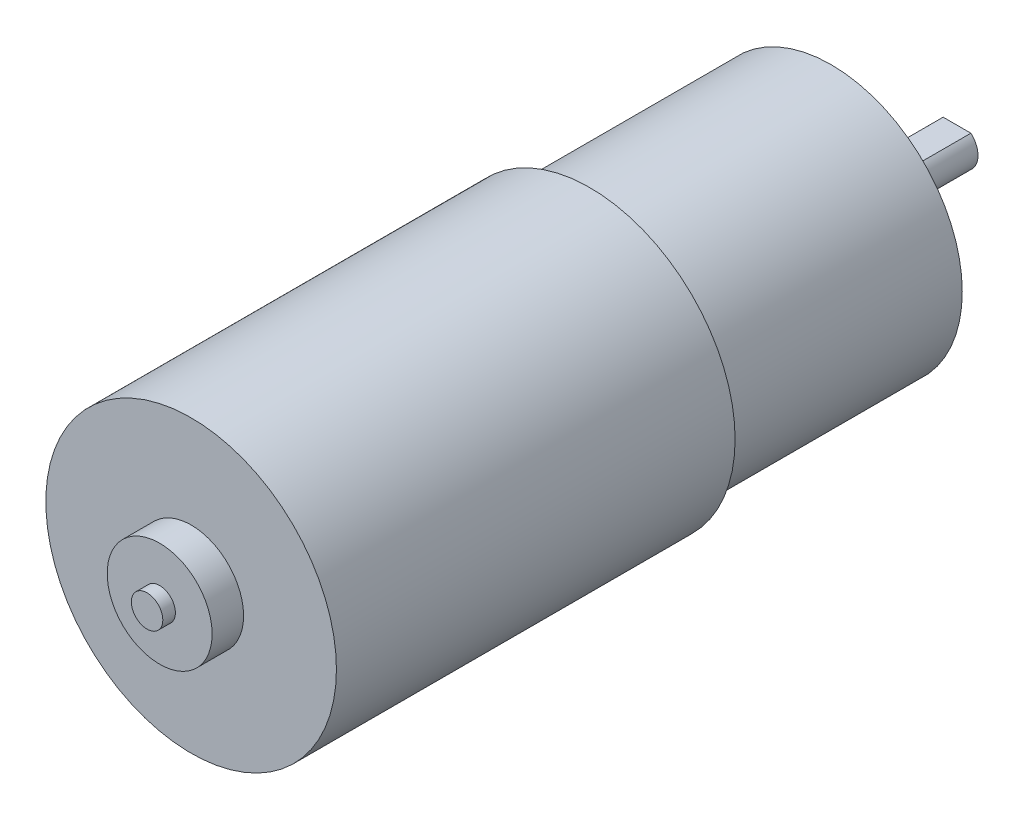
from build123d import *
from build123d.topology import SkipClean

# Parameters (mm, degrees)
SKETCH1_R           = 12.5
BOSS_EXTRUDE1_DEPTH = 23
SKETCH2_R           = 13.85
BOSS_EXTRUDE2_DEPTH = 38
SKETCH3_R           = 5
BOSS_EXTRUDE3_DEPTH = 3
SKETCH4_R           = 1.5
BOSS_EXTRUDE4_DEPTH = 1.2
SKETCH5_R           = 3.5
BOSS_EXTRUDE5_DEPTH = 2.5
SKETCH6_R           = 2
BOSS_EXTRUDE6_DEPTH = 9.5
CUT_EXTRUDE1_START  = -8
CUT_EXTRUDE1_DEPTH  = 8
SKETCH8_R           = 1.5
CUT_EXTRUDE3_DEPTH  = 6.5
THREAD2_PITCH       = 0.5
THREAD3_PITCH       = 0.5


with BuildPart() as part:
    # Sketch1 → Boss-Extrude1 (new body)
    with BuildSketch(Plane.XY):
        Circle(SKETCH1_R)
    extrude(amount=BOSS_EXTRUDE1_DEPTH)

    # Sketch2 → Boss-Extrude2 (add)
    with BuildSketch(Plane.XY.offset(23)):
        Circle(SKETCH2_R)
    extrude(amount=BOSS_EXTRUDE2_DEPTH)

    # Sketch3 → Boss-Extrude3 (add)
    with BuildSketch(Plane.XY.offset(61)):
        Circle(SKETCH3_R)
    extrude(amount=BOSS_EXTRUDE3_DEPTH)

    # Sketch4 → Boss-Extrude4 (add)
    with BuildSketch(Plane.XY.offset(64)):
        Circle(SKETCH4_R)
    extrude(amount=BOSS_EXTRUDE4_DEPTH)

    # Sketch5 → Boss-Extrude5 (add)
    with BuildSketch(Plane.XY):
        Circle(SKETCH5_R)
    extrude(amount=-BOSS_EXTRUDE5_DEPTH)

    # Sketch6 → Boss-Extrude6 (add)
    with BuildSketch(Plane(origin=(0, 0, -2.5), x_dir=(-1, 0, 0), z_dir=(0, 0, -1))):
        Circle(SKETCH6_R)
    extrude(amount=BOSS_EXTRUDE6_DEPTH)

    # Sketch7 → Cut-Extrude1 (cut)
    with BuildSketch(Plane(origin=(0, 0, -12), x_dir=(-1, 0, 0), z_dir=(0, 0, -1)).offset(CUT_EXTRUDE1_START)):
        with BuildLine():
            Line((-1.322875656, 1.5), (1.322875656, 1.5))
            ThreePointArc((1.322875656, 1.5), (0, 2), (-1.322875656, 1.5))
        make_face()
    extrude(amount=CUT_EXTRUDE1_DEPTH, mode=Mode.SUBTRACT)

    # Sketch8 → Cut-Extrude3 (cut)
    with BuildSketch(Plane(origin=(0, 0, 0), x_dir=(-1, 0, 0), z_dir=(0, 0, -1))):
        with Locations((0, 8.5)):
            Circle(SKETCH8_R)
        with Locations((0, -8.5)):
            Circle(SKETCH8_R)
    extrude(amount=-CUT_EXTRUDE3_DEPTH, mode=Mode.SUBTRACT)

    # Thread2: the profile of Thread Profile2 profile screwed along a right-hand helix of 13 turns, 6 arcs to a turn; built about Z, then put on its axis
    with SkipClean():  # the faces are left unmerged after this step: merging them gives an invalid solid
        thread2_z = Axis((0, 0, 0), (0, 0, 1))
        thread2_corners = [(1.4997, 0, -0.000173205), (1.770632937, 0, 0.156249999), (1.770632937, 0, 0.218749999), (1.4997, 0, 0.375173204)]
        with BuildLine(mode=Mode.PRIVATE) as thread2_profile:
            Line(thread2_corners[0], thread2_corners[1])
            Line(thread2_corners[1], thread2_corners[2])
            Line(thread2_corners[2], thread2_corners[3])
            Line(thread2_corners[3], thread2_corners[0])
        thread2_cap = Face(thread2_profile.wire())
        thread2_turn_angles = [0, 30, 60, 90, 120, 150, 180, 210, 240, 270, 300, 330, 360]
        thread2_turn_weights = [1, 0.8660254037844387, 1, 0.8660254037844387, 1, 0.8660254037844387, 1, 0.8660254037844387, 1, 0.8660254037844387, 1, 0.8660254037844387, 1]
        thread2_turn_rails = [Edge.make_bspline([Vector(p[0], p[1], 0).rotate(thread2_z, thread2_turn_angles[k]) / thread2_turn_weights[k] + Vector(0, 0, p[2] + THREAD2_PITCH * thread2_turn_angles[k] / 360) for k in range(13)], [0, 0, 0, 1, 1, 2, 2, 3, 3, 4, 4, 5, 5, 6, 6, 6], 2, thread2_turn_weights) for p in thread2_corners]
        thread2_turn_sides = [Face.make_surface_from_curves(thread2_turn_rails[p[0]], thread2_turn_rails[p[1]]) for p in [(0, 1), (1, 2), (2, 3), (3, 0)]]
        thread2 = Plane(origin=(0, -8.5, 0), x_dir=(1, 0, 0), z_dir=(0, 0, 1)) * Solid(Shell([*[p.moved(Location((0, 0, THREAD2_PITCH * i))) for i in range(13) for p in thread2_turn_sides], thread2_cap, thread2_cap.rotate(thread2_z, 4680).moved(Location((0, 0, THREAD2_PITCH * 4680 / 360)))]))
        add(thread2, mode=Mode.SUBTRACT)

    # Thread3: the profile of Thread Profile3 profile screwed along a right-hand helix of 13 turns, 6 arcs to a turn; built about Z, then put on its axis
    with SkipClean():  # the faces are left unmerged after this step: merging them gives an invalid solid
        thread3_z = Axis((0, 0, 0), (0, 0, 1))
        thread3_corners = [(1.4997, 0, -0.000173205), (1.770632937, 0, 0.156249999), (1.770632937, 0, 0.218749999), (1.4997, 0, 0.375173204)]
        with BuildLine(mode=Mode.PRIVATE) as thread3_profile:
            Line(thread3_corners[0], thread3_corners[1])
            Line(thread3_corners[1], thread3_corners[2])
            Line(thread3_corners[2], thread3_corners[3])
            Line(thread3_corners[3], thread3_corners[0])
        thread3_cap = Face(thread3_profile.wire())
        thread3_turn_angles = [0, 30, 60, 90, 120, 150, 180, 210, 240, 270, 300, 330, 360]
        thread3_turn_weights = [1, 0.8660254037844387, 1, 0.8660254037844387, 1, 0.8660254037844387, 1, 0.8660254037844387, 1, 0.8660254037844387, 1, 0.8660254037844387, 1]
        thread3_turn_rails = [Edge.make_bspline([Vector(p[0], p[1], 0).rotate(thread3_z, thread3_turn_angles[k]) / thread3_turn_weights[k] + Vector(0, 0, p[2] + THREAD3_PITCH * thread3_turn_angles[k] / 360) for k in range(13)], [0, 0, 0, 1, 1, 2, 2, 3, 3, 4, 4, 5, 5, 6, 6, 6], 2, thread3_turn_weights) for p in thread3_corners]
        thread3_turn_sides = [Face.make_surface_from_curves(thread3_turn_rails[p[0]], thread3_turn_rails[p[1]]) for p in [(0, 1), (1, 2), (2, 3), (3, 0)]]
        thread3 = Plane(origin=(0, 8.5, 0), x_dir=(1, 0, 0), z_dir=(0, 0, 1)) * Solid(Shell([*[p.moved(Location((0, 0, THREAD3_PITCH * i))) for i in range(13) for p in thread3_turn_sides], thread3_cap, thread3_cap.rotate(thread3_z, 4680).moved(Location((0, 0, THREAD3_PITCH * 4680 / 360)))]))
        add(thread3, mode=Mode.SUBTRACT)


solid = part.part
